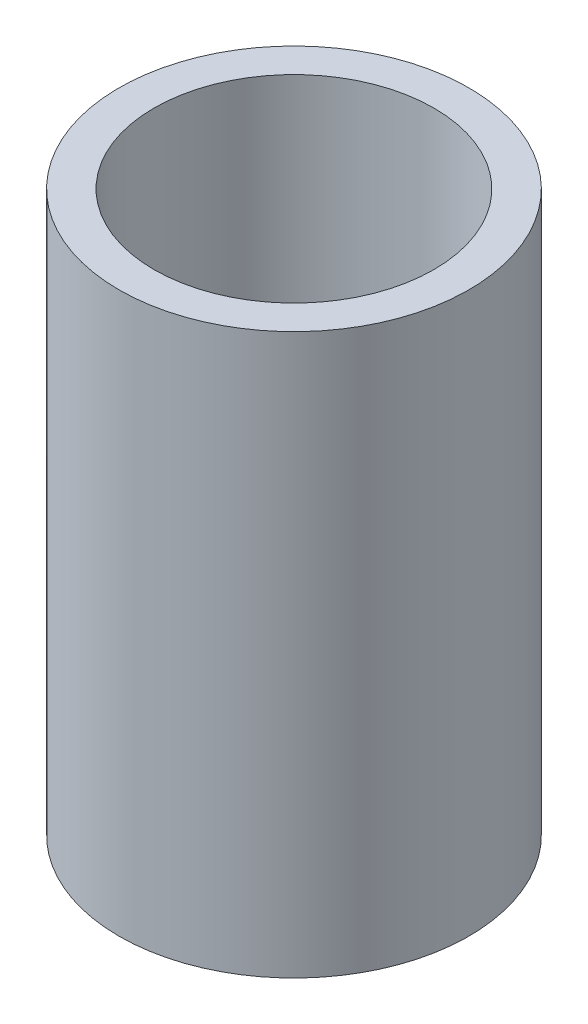
from build123d import *

# Parameters (mm, degrees)
SKETCH2_R           = 63.5
SKETCH2_R_2         = 50.8
BOSS_EXTRUDE1_DEPTH = 203.2


with BuildPart() as part:
    # Sketch2 → Boss-Extrude1 (new body)
    with BuildSketch(Plane(origin=(0, 0, 0), x_dir=(1, 0, 0), z_dir=(0, 1, 0))):
        Circle(SKETCH2_R)
        Circle(SKETCH2_R_2, mode=Mode.SUBTRACT)
    extrude(amount=BOSS_EXTRUDE1_DEPTH)


solid = part.part
